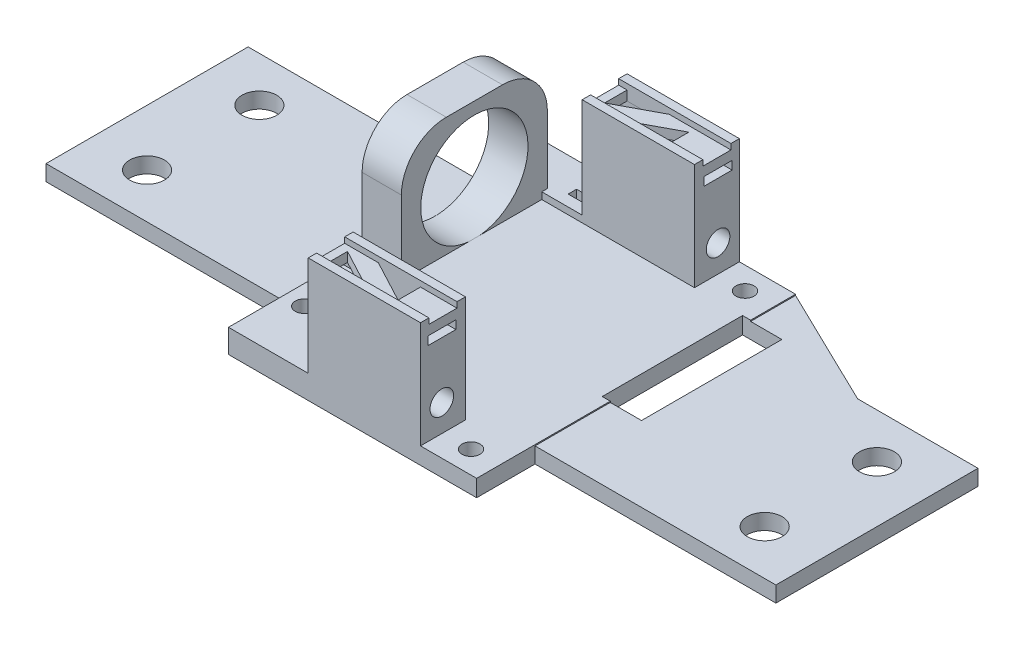
from build123d import *
from build123d.topology import SkipClean

# Parameters (mm, degrees)
BOSS_EXTRU_1_DEPTH           = 4.2
ESQUISSE2_W                  = 5
ESQUISSE2_H                  = 8
BOSS_EXTRU_2_DEPTH           = 22
ENL_V_MAT_EXTRU_2_REACH      = 71.856
ESQUISSE4_R                  = 1.6
EXTRU_MINCE1_OUTLINE_W       = 15
EXTRU_MINCE1_OUTLINE_H       = 8
EXTRU_MINCE1_DEPTH           = 17.8
BOSS_EXTRU_3_DEPTH           = 3
ESQUISSE3_R                  = 2.1
ESQUISSE3_W                  = 5
ESQUISSE3_H                  = 1.5
ENL_V_MAT_EXTRU_1_DEPTH      = 70.856137884
ENL_V_MAT_EXTRU_3_REACH      = 76.437
ESQUISSE7_R                  = 1.6
ESQUISSE8_W                  = 20
ESQUISSE8_H                  = 5
ENL_V_MAT_EXTRU_5_DEPTH      = 1
ESQUISSE9_W                  = 7
ESQUISSE9_H                  = 26
BOSS_EXTRU_4_DEPTH           = 20
ESQUISSE10_R                 = 9.55
ENL_V_MAT_EXTRU_6_DEPTH      = 7
CONG_1_R                     = 8
ESQUISSE11_W                 = 4
ESQUISSE11_H                 = 1.5
ENL_V_MAT_EXTRU_7_DEPTH      = 75.698594364
ESQUISSE12_W                 = 4
ESQUISSE12_H                 = 44.8
ENL_V_MAT_EXTRU_8_DEPTH      = 1
ESQUISSE13_R                 = 3.1
ESQUISSE13_W                 = 42.9
ESQUISSE13_H                 = 36
BOSS_EXTRU_5_DEPTH           = 2.8
ENL_V_MAT_EXTRU_9_DEPTH      = 107.163129193
ENL_V_MAT_EXTRU_9_DEPTH_BACK = 107.163129193
ESQUISSE14_W                 = 7
ESQUISSE14_H                 = 25


# Read off the part's stored shape, not the designer's step: Extru.-Mince1
with BuildPart() as part:
    # Esquisse1 → Boss.-Extru.1 (new body)
    with BuildSketch(Plane(origin=(0, 0, 0), x_dir=(1, 0, 0), z_dir=(0, 1, 0))):
        Polygon((0, 0), (29.2, 0), (29.2, 8), (7, 8), (7, 48.8), (29.2, 48.8), (29.2, 56.8), (0, 56.8), align=None)
    extrude(amount=BOSS_EXTRU_1_DEPTH)

    # Esquisse2 → Boss.-Extru.2 (add)
    with BuildSketch(Plane(origin=(0, 0, 0), x_dir=(1, 0, 0), z_dir=(0, 1, 0))):
        with Locations((31.7, 52.8)):
            Rectangle(ESQUISSE2_W, ESQUISSE2_H)
        with Locations((31.7, 4)):
            Rectangle(ESQUISSE2_W, ESQUISSE2_H)
    extrude(amount=BOSS_EXTRU_2_DEPTH)

    # Esquisse4 → Enlèv. mat.-Extru.2 (cut, up to next)
    with BuildSketch(Plane(origin=(0, 0, 0), x_dir=(1, 0, 0), z_dir=(0, 1, 0)), mode=Mode.PRIVATE) as enl_v_mat_extru_2_sk1:
        with Locations(Location((3.5, 10, 0), (0, 0, 270))):
            Circle(ESQUISSE4_R)
    enl_v_mat_extru_2_tool1 = extrude(enl_v_mat_extru_2_sk1.sketch, amount=ENL_V_MAT_EXTRU_2_REACH, mode=Mode.PRIVATE) & part.part
    add(enl_v_mat_extru_2_tool1.solids().sort_by_distance((3.5, 0, -10))[0], mode=Mode.SUBTRACT)

    # Extru.-Mince1 outline → Extru.-Mince1 (add)
    with BuildSketch(Plane(origin=(0, 4.2, 0), x_dir=(1, 0, 0), z_dir=(0, 1, 0))):
        with Locations((21.7, 52.8)):
            Rectangle(EXTRU_MINCE1_OUTLINE_W, EXTRU_MINCE1_OUTLINE_H)
        Polygon((27.7, 50.3), (20.2, 50.3), (27.7, 54.3), align=None, mode=Mode.SUBTRACT)
        Polygon((15.7, 51.3), (15.7, 55.3), (23.2, 55.3), align=None, mode=Mode.SUBTRACT)
    extru_mince1 = extrude(amount=EXTRU_MINCE1_DEPTH)

    # Esquisse6 → Boss.-Extru.3 (add)
    with BuildSketch(Plane.XZ):
        Polygon((34.2, -8), (7, -8), (7, -48.8), (34.2, -48.8), (34.2, -56.8), (44.2, -56.8), (44.2, 0), (34.2, 0), align=None)
    extrude(amount=-BOSS_EXTRU_3_DEPTH)

    # Esquisse3 → Enlèv. mat.-Extru.1 (cut, through all)
    with BuildSketch(Plane(origin=(34.2, 0, 0), x_dir=(0, 0, -1), z_dir=(1, 0, 0))):
        with Locations((3.8, 7.8)):
            Circle(ESQUISSE3_R)
        with Locations((53, 7.8)):
            Circle(ESQUISSE3_R)
        with Locations((3.8, 18.55)):
            Rectangle(ESQUISSE3_W, ESQUISSE3_H)
        with Locations((53, 18.55)):
            Rectangle(ESQUISSE3_W, ESQUISSE3_H)
    enl_v_mat_extru_1 = extrude(amount=-ENL_V_MAT_EXTRU_1_DEPTH, mode=Mode.SUBTRACT)

    # Symétrie1: Extru.-Mince1, Enlèv. mat.-Extru.1 across plane
    with SkipClean():  # the faces are left unmerged after this step: merging them gives an invalid solid
        add(extru_mince1.mirror(Plane(origin=(0, 0, -28.4), x_dir=(1, 0, 0), z_dir=(0, 0, -1))))
        add(enl_v_mat_extru_1.mirror(Plane(origin=(0, 0, -28.4), x_dir=(1, 0, 0), z_dir=(0, 0, -1))), mode=Mode.SUBTRACT)

    # Esquisse7 → Enlèv. mat.-Extru.3 (cut, up to next)
    with BuildSketch(Plane(origin=(0, 3, 0), x_dir=(1, 0, 0), z_dir=(0, 1, 0)), mode=Mode.PRIVATE) as enl_v_mat_extru_3_sk1:
        with Locations(Location((39.2, 52.8, 0), (0, 0, 270))):
            Circle(ESQUISSE7_R)
    enl_v_mat_extru_3_tool1 = extrude(enl_v_mat_extru_3_sk1.sketch, amount=-ENL_V_MAT_EXTRU_3_REACH, mode=Mode.PRIVATE) & part.part
    # Esquisse7 → Enlèv. mat.-Extru.3 (cut, up to next)
    with BuildSketch(Plane(origin=(0, 3, 0), x_dir=(1, 0, 0), z_dir=(0, 1, 0)), mode=Mode.PRIVATE) as enl_v_mat_extru_3_sk2:
        with Locations(Location((39.2, 4, 0), (0, 0, 270))):
            Circle(ESQUISSE7_R)
    enl_v_mat_extru_3_tool2 = extrude(enl_v_mat_extru_3_sk2.sketch, amount=-ENL_V_MAT_EXTRU_3_REACH, mode=Mode.PRIVATE) & part.part
    add(enl_v_mat_extru_3_tool1.solids().sort_by_distance((39.2, 3, -52.8))[0], mode=Mode.SUBTRACT)
    add(enl_v_mat_extru_3_tool2.solids().sort_by_distance((39.2, 3, -4))[0], mode=Mode.SUBTRACT)

    # Esquisse8 → Enlèv. mat.-Extru.5 (cut)
    with SkipClean():  # the faces are left unmerged after this step: merging them gives an invalid solid
        with BuildSketch(Plane(origin=(0, 22, 0), x_dir=(1, 0, 0), z_dir=(0, 1, 0))):
            with Locations((24.2, 52.8)):
                Rectangle(ESQUISSE8_W, ESQUISSE8_H)
            with Locations((24.2, 4)):
                Rectangle(ESQUISSE8_W, ESQUISSE8_H)
        extrude(amount=-ENL_V_MAT_EXTRU_5_DEPTH, mode=Mode.SUBTRACT)

    # Esquisse9 → Boss.-Extru.4 (add)
    with SkipClean():  # the faces are left unmerged after this step: merging them gives an invalid solid
        with BuildSketch(Plane(origin=(0, 4.2, 0), x_dir=(1, 0, 0), z_dir=(0, 1, 0))):
            with Locations((3.5, 36.8)):
                Rectangle(ESQUISSE9_W, ESQUISSE9_H)
        extrude(amount=BOSS_EXTRU_4_DEPTH)

    # Esquisse10 → Enlèv. mat.-Extru.6 (cut)
    with SkipClean():  # the faces are left unmerged after this step: merging them gives an invalid solid
        with BuildSketch(Plane.ZY):
            with Locations((-36.8, 12.49)):
                Circle(ESQUISSE10_R)
        extrude(amount=-ENL_V_MAT_EXTRU_6_DEPTH, mode=Mode.SUBTRACT)

    # Congé1
    cong_1_edges = [part.edges().sort_by_distance(p)[0] for p in [
        (3.5, 24.2, -23.8),
        (3.5, 24.2, -49.8),
    ]]
    fillet(cong_1_edges, radius=CONG_1_R)

    # Esquisse11 → Enlèv. mat.-Extru.7 (cut, through all)
    with SkipClean():  # the faces are left unmerged after this step: merging them gives an invalid solid
        with BuildSketch(Plane(origin=(0, 4.2, 0), x_dir=(1, 0, 0), z_dir=(0, 1, 0))):
            with Locations((11.7, 51.55)):
                Rectangle(ESQUISSE11_W, ESQUISSE11_H)
            with Locations((11.7, 5.25)):
                Rectangle(ESQUISSE11_W, ESQUISSE11_H)
        extrude(amount=-ENL_V_MAT_EXTRU_7_DEPTH, mode=Mode.SUBTRACT)

    # Esquisse12 → Enlèv. mat.-Extru.8 (cut)
    with SkipClean():  # the faces are left unmerged after this step: merging them gives an invalid solid
        with BuildSketch(Plane.XZ):
            with Locations((11.7, -28.4)):
                Rectangle(ESQUISSE12_W, ESQUISSE12_H)
        extrude(amount=-ENL_V_MAT_EXTRU_8_DEPTH, mode=Mode.SUBTRACT)

    # Esquisse13 → Boss.-Extru.5 (add)
    # profile 1 of 2: a face of its own
    with SkipClean():  # the faces are left unmerged after this step: merging them gives an invalid solid
        with BuildSketch(Plane(origin=(0, 0, 0), x_dir=(1, 0, 0), z_dir=(0, 1, 0))):
            Polygon((65.65, 46.4), (87.1, 46.4), (87.1, 10.4), (44.2, 10.4), (44.2, 46.4), (44.2, 56.8), align=None)
            with Locations(Location((77.1, 38.4, 0), (0, 0, 270))):
                Circle(ESQUISSE13_R, mode=Mode.SUBTRACT)
            with Locations(Location((77.1, 18.4, 0), (0, 0, 270))):
                Circle(ESQUISSE13_R, mode=Mode.SUBTRACT)
        # profile 2 of 2: a face of its own
        with BuildSketch(Plane(origin=(0, 0, 0), x_dir=(1, 0, 0), z_dir=(0, 1, 0))):
            with Locations((-21.45, 28.4)):
                Rectangle(ESQUISSE13_W, ESQUISSE13_H)
            with Locations(Location((-32.9, 18.4, 0), (0, 0, 270))):
                Circle(ESQUISSE13_R, mode=Mode.SUBTRACT)
            with Locations(Location((-32.9, 38.4, 0), (0, 0, 270))):
                Circle(ESQUISSE13_R, mode=Mode.SUBTRACT)
        extrude(amount=BOSS_EXTRU_5_DEPTH)

    # Esquisse14 → Enlèv. mat.-Extru.9 (cut, two sides: drawn at the far end of the back side and taken through both)
    with SkipClean():  # the faces are left unmerged after this step: merging them gives an invalid solid
        with BuildSketch(Plane(origin=(0, 2.8, 0), x_dir=(1, 0, 0), z_dir=(0, 1, 0)).offset(-ENL_V_MAT_EXTRU_9_DEPTH_BACK)):
            with Locations((46.266692991, 36.3)):
                Rectangle(ESQUISSE14_W, ESQUISSE14_H)
        extrude(amount=ENL_V_MAT_EXTRU_9_DEPTH + ENL_V_MAT_EXTRU_9_DEPTH_BACK, mode=Mode.SUBTRACT)


solid = part.part
